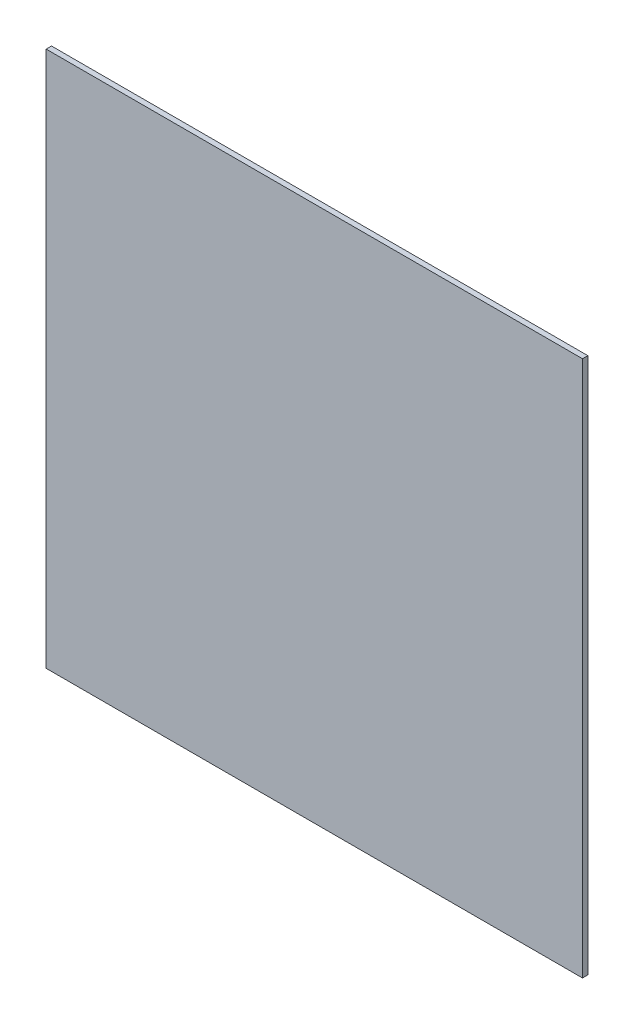
from build123d import *

# Parameters (mm, degrees)
SKETCH1_W          = 304.8
SKETCH1_H          = 304.8
BASE_FLANGE1_DEPTH = 3.048


# Sheet-metal steps are written as plain solids
with BuildPart() as part:
    # Sketch1 → Base-Flange1 (new body)
    with BuildSketch(Plane.XY):
        with Locations((152.4, 152.4)):
            Rectangle(SKETCH1_W, SKETCH1_H)
    extrude(amount=BASE_FLANGE1_DEPTH)


solid = part.part
